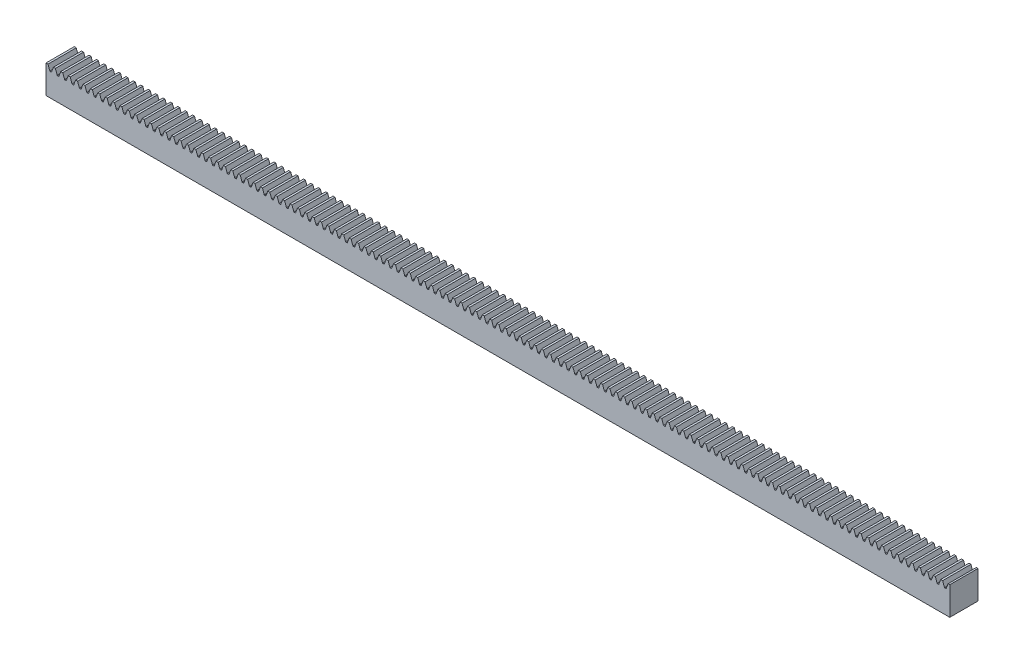
from build123d import *

# Parameters (mm, degrees)
SKETCH1_W           = 609.6
SKETCH1_H           = 19.05
BOSS_EXTRUDE1_DEPTH = 9.525
CUT_EXTRUDE1_DEPTH  = 19.05
FILLET3_R           = 0.320981709
LPATTERN4_START     = -9.525
LPATTERN4_DEPTH     = 19.05


# Read off the part's stored shape, not the designer's step: LPattern4
with BuildPart() as part:
    # Sketch1 → Boss-Extrude1 (new, symmetric)
    with BuildSketch(Plane.XY):
        Rectangle(SKETCH1_W, SKETCH1_H)
    extrude(amount=BOSS_EXTRUDE1_DEPTH, both=True)

    # Sketch2 → Cut-Extrude1 (cut)
    with BuildSketch(Plane.XY.offset(9.525)):
        Polygon((-303.461960494, 9.525), (-302.172304763, 5.9817), (-301.102365731, 5.9817), (-299.81271, 9.525), align=None)
    extrude(amount=-CUT_EXTRUDE1_DEPTH, mode=Mode.SUBTRACT)

    # Fillet3
    fillet3_edges = [part.edges().sort_by_distance(p)[0] for p in [
        (-301.102365731, 5.9817, 0),
        (-302.172304763, 5.9817, 0),
    ]]
    fillet(fillet3_edges, radius=FILLET3_R)

    # LPattern4 outline → LPattern4 (cut)
    with BuildSketch(Plane.XY.offset(LPATTERN4_START)):
        with BuildLine():
            ThreePointArc((-297.261885094, 6.192899499), (-297.144368495, 6.039748886), (-296.96026095, 5.9817))
            Line((-296.96026095, 5.9817), (-296.339829544, 5.9817))
            ThreePointArc((-296.339829544, 5.9817), (-296.155721999, 6.039748886), (-296.0382054, 6.192899499))
            Line((-296.0382054, 6.192899499), (-294.82542, 9.525))
            Line((-294.82542, 9.525), (-298.474670494, 9.525))
            Line((-298.474670494, 9.525), (-297.261885094, 6.192899499))
        make_face()
        with BuildLine():
            Line((303.64938, 9.525), (300.000129506, 9.525))
            Line((300.000129506, 9.525), (301.212914906, 6.192899499))
            ThreePointArc((301.212914906, 6.192899499), (301.330431505, 6.039748886), (301.51453905, 5.9817))
            Line((301.51453905, 5.9817), (302.134970456, 5.9817))
            ThreePointArc((302.134970456, 5.9817), (302.319078001, 6.039748886), (302.4365946, 6.192899499))
            Line((302.4365946, 6.192899499), (303.64938, 9.525))
        make_face()
        with BuildLine():
            Line((298.66209, 9.525), (295.012839506, 9.525))
            Line((295.012839506, 9.525), (296.225624906, 6.192899499))
            ThreePointArc((296.225624906, 6.192899499), (296.343141505, 6.039748886), (296.52724905, 5.9817))
            Line((296.52724905, 5.9817), (297.147680456, 5.9817))
            ThreePointArc((297.147680456, 5.9817), (297.331788001, 6.039748886), (297.4493046, 6.192899499))
            Line((297.4493046, 6.192899499), (298.66209, 9.525))
        make_face()
        with BuildLine():
            Line((293.6748, 9.525), (290.025549506, 9.525))
            Line((290.025549506, 9.525), (291.238334906, 6.192899499))
            ThreePointArc((291.238334906, 6.192899499), (291.355851505, 6.039748886), (291.53995905, 5.9817))
            Line((291.53995905, 5.9817), (292.160390456, 5.9817))
            ThreePointArc((292.160390456, 5.9817), (292.344498001, 6.039748886), (292.4620146, 6.192899499))
            Line((292.4620146, 6.192899499), (293.6748, 9.525))
        make_face()
        with BuildLine():
            Line((288.68751, 9.525), (285.038259506, 9.525))
            Line((285.038259506, 9.525), (286.251044906, 6.192899499))
            ThreePointArc((286.251044906, 6.192899499), (286.368561505, 6.039748886), (286.55266905, 5.9817))
            Line((286.55266905, 5.9817), (287.173100456, 5.9817))
            ThreePointArc((287.173100456, 5.9817), (287.357208001, 6.039748886), (287.4747246, 6.192899499))
            Line((287.4747246, 6.192899499), (288.68751, 9.525))
        make_face()
        with BuildLine():
            Line((283.70022, 9.525), (280.050969506, 9.525))
            Line((280.050969506, 9.525), (281.263754906, 6.192899499))
            ThreePointArc((281.263754906, 6.192899499), (281.381271505, 6.039748886), (281.56537905, 5.9817))
            Line((281.56537905, 5.9817), (282.185810456, 5.9817))
            ThreePointArc((282.185810456, 5.9817), (282.369918001, 6.039748886), (282.4874346, 6.192899499))
            Line((282.4874346, 6.192899499), (283.70022, 9.525))
        make_face()
        with BuildLine():
            Line((278.71293, 9.525), (275.063679506, 9.525))
            Line((275.063679506, 9.525), (276.276464906, 6.192899499))
            ThreePointArc((276.276464906, 6.192899499), (276.393981505, 6.039748886), (276.57808905, 5.9817))
            Line((276.57808905, 5.9817), (277.198520456, 5.9817))
            ThreePointArc((277.198520456, 5.9817), (277.382628001, 6.039748886), (277.5001446, 6.192899499))
            Line((277.5001446, 6.192899499), (278.71293, 9.525))
        make_face()
        with BuildLine():
            Line((273.72564, 9.525), (270.076389506, 9.525))
            Line((270.076389506, 9.525), (271.289174906, 6.192899499))
            ThreePointArc((271.289174906, 6.192899499), (271.406691505, 6.039748886), (271.59079905, 5.9817))
            Line((271.59079905, 5.9817), (272.211230456, 5.9817))
            ThreePointArc((272.211230456, 5.9817), (272.395338001, 6.039748886), (272.5128546, 6.192899499))
            Line((272.5128546, 6.192899499), (273.72564, 9.525))
        make_face()
        with BuildLine():
            Line((268.73835, 9.525), (265.089099506, 9.525))
            Line((265.089099506, 9.525), (266.301884906, 6.192899499))
            ThreePointArc((266.301884906, 6.192899499), (266.419401505, 6.039748886), (266.60350905, 5.9817))
            Line((266.60350905, 5.9817), (267.223940456, 5.9817))
            ThreePointArc((267.223940456, 5.9817), (267.408048001, 6.039748886), (267.5255646, 6.192899499))
            Line((267.5255646, 6.192899499), (268.73835, 9.525))
        make_face()
        with BuildLine():
            Line((263.75106, 9.525), (260.101809506, 9.525))
            Line((260.101809506, 9.525), (261.314594906, 6.192899499))
            ThreePointArc((261.314594906, 6.192899499), (261.432111505, 6.039748886), (261.61621905, 5.9817))
            Line((261.61621905, 5.9817), (262.236650456, 5.9817))
            ThreePointArc((262.236650456, 5.9817), (262.420758001, 6.039748886), (262.5382746, 6.192899499))
            Line((262.5382746, 6.192899499), (263.75106, 9.525))
        make_face()
        with BuildLine():
            Line((258.76377, 9.525), (255.114519506, 9.525))
            Line((255.114519506, 9.525), (256.327304906, 6.192899499))
            ThreePointArc((256.327304906, 6.192899499), (256.444821505, 6.039748886), (256.62892905, 5.9817))
            Line((256.62892905, 5.9817), (257.249360456, 5.9817))
            ThreePointArc((257.249360456, 5.9817), (257.433468001, 6.039748886), (257.5509846, 6.192899499))
            Line((257.5509846, 6.192899499), (258.76377, 9.525))
        make_face()
        with BuildLine():
            Line((253.77648, 9.525), (250.127229506, 9.525))
            Line((250.127229506, 9.525), (251.340014906, 6.192899499))
            ThreePointArc((251.340014906, 6.192899499), (251.457531505, 6.039748886), (251.64163905, 5.9817))
            Line((251.64163905, 5.9817), (252.262070456, 5.9817))
            ThreePointArc((252.262070456, 5.9817), (252.446178001, 6.039748886), (252.5636946, 6.192899499))
            Line((252.5636946, 6.192899499), (253.77648, 9.525))
        make_face()
        with BuildLine():
            Line((248.78919, 9.525), (245.139939506, 9.525))
            Line((245.139939506, 9.525), (246.352724906, 6.192899499))
            ThreePointArc((246.352724906, 6.192899499), (246.470241505, 6.039748886), (246.65434905, 5.9817))
            Line((246.65434905, 5.9817), (247.274780456, 5.9817))
            ThreePointArc((247.274780456, 5.9817), (247.458888001, 6.039748886), (247.5764046, 6.192899499))
            Line((247.5764046, 6.192899499), (248.78919, 9.525))
        make_face()
        with BuildLine():
            Line((243.8019, 9.525), (240.152649506, 9.525))
            Line((240.152649506, 9.525), (241.365434906, 6.192899499))
            ThreePointArc((241.365434906, 6.192899499), (241.482951505, 6.039748886), (241.66705905, 5.9817))
            Line((241.66705905, 5.9817), (242.287490456, 5.9817))
            ThreePointArc((242.287490456, 5.9817), (242.471598001, 6.039748886), (242.5891146, 6.192899499))
            Line((242.5891146, 6.192899499), (243.8019, 9.525))
        make_face()
        with BuildLine():
            Line((238.81461, 9.525), (235.165359506, 9.525))
            Line((235.165359506, 9.525), (236.378144906, 6.192899499))
            ThreePointArc((236.378144906, 6.192899499), (236.495661505, 6.039748886), (236.67976905, 5.9817))
            Line((236.67976905, 5.9817), (237.300200456, 5.9817))
            ThreePointArc((237.300200456, 5.9817), (237.484308001, 6.039748886), (237.6018246, 6.192899499))
            Line((237.6018246, 6.192899499), (238.81461, 9.525))
        make_face()
        with BuildLine():
            Line((233.82732, 9.525), (230.178069506, 9.525))
            Line((230.178069506, 9.525), (231.390854906, 6.192899499))
            ThreePointArc((231.390854906, 6.192899499), (231.508371505, 6.039748886), (231.69247905, 5.9817))
            Line((231.69247905, 5.9817), (232.312910456, 5.9817))
            ThreePointArc((232.312910456, 5.9817), (232.497018001, 6.039748886), (232.6145346, 6.192899499))
            Line((232.6145346, 6.192899499), (233.82732, 9.525))
        make_face()
        with BuildLine():
            Line((228.84003, 9.525), (225.190779506, 9.525))
            Line((225.190779506, 9.525), (226.403564906, 6.192899499))
            ThreePointArc((226.403564906, 6.192899499), (226.521081505, 6.039748886), (226.70518905, 5.9817))
            Line((226.70518905, 5.9817), (227.325620456, 5.9817))
            ThreePointArc((227.325620456, 5.9817), (227.509728001, 6.039748886), (227.6272446, 6.192899499))
            Line((227.6272446, 6.192899499), (228.84003, 9.525))
        make_face()
        with BuildLine():
            Line((223.85274, 9.525), (220.203489506, 9.525))
            Line((220.203489506, 9.525), (221.416274906, 6.192899499))
            ThreePointArc((221.416274906, 6.192899499), (221.533791505, 6.039748886), (221.71789905, 5.9817))
            Line((221.71789905, 5.9817), (222.338330456, 5.9817))
            ThreePointArc((222.338330456, 5.9817), (222.522438001, 6.039748886), (222.6399546, 6.192899499))
            Line((222.6399546, 6.192899499), (223.85274, 9.525))
        make_face()
        with BuildLine():
            Line((218.86545, 9.525), (215.216199506, 9.525))
            Line((215.216199506, 9.525), (216.428984906, 6.192899499))
            ThreePointArc((216.428984906, 6.192899499), (216.546501505, 6.039748886), (216.73060905, 5.9817))
            Line((216.73060905, 5.9817), (217.351040456, 5.9817))
            ThreePointArc((217.351040456, 5.9817), (217.535148001, 6.039748886), (217.6526646, 6.192899499))
            Line((217.6526646, 6.192899499), (218.86545, 9.525))
        make_face()
        with BuildLine():
            Line((213.87816, 9.525), (210.228909506, 9.525))
            Line((210.228909506, 9.525), (211.441694906, 6.192899499))
            ThreePointArc((211.441694906, 6.192899499), (211.559211505, 6.039748886), (211.74331905, 5.9817))
            Line((211.74331905, 5.9817), (212.363750456, 5.9817))
            ThreePointArc((212.363750456, 5.9817), (212.547858001, 6.039748886), (212.6653746, 6.192899499))
            Line((212.6653746, 6.192899499), (213.87816, 9.525))
        make_face()
        with BuildLine():
            Line((208.89087, 9.525), (205.241619506, 9.525))
            Line((205.241619506, 9.525), (206.454404906, 6.192899499))
            ThreePointArc((206.454404906, 6.192899499), (206.571921505, 6.039748886), (206.75602905, 5.9817))
            Line((206.75602905, 5.9817), (207.376460456, 5.9817))
            ThreePointArc((207.376460456, 5.9817), (207.560568001, 6.039748886), (207.6780846, 6.192899499))
            Line((207.6780846, 6.192899499), (208.89087, 9.525))
        make_face()
        with BuildLine():
            Line((203.90358, 9.525), (200.254329506, 9.525))
            Line((200.254329506, 9.525), (201.467114906, 6.192899499))
            ThreePointArc((201.467114906, 6.192899499), (201.584631505, 6.039748886), (201.76873905, 5.9817))
            Line((201.76873905, 5.9817), (202.389170456, 5.9817))
            ThreePointArc((202.389170456, 5.9817), (202.573278001, 6.039748886), (202.6907946, 6.192899499))
            Line((202.6907946, 6.192899499), (203.90358, 9.525))
        make_face()
        with BuildLine():
            Line((198.91629, 9.525), (195.267039506, 9.525))
            Line((195.267039506, 9.525), (196.479824906, 6.192899499))
            ThreePointArc((196.479824906, 6.192899499), (196.597341505, 6.039748886), (196.78144905, 5.9817))
            Line((196.78144905, 5.9817), (197.401880456, 5.9817))
            ThreePointArc((197.401880456, 5.9817), (197.585988001, 6.039748886), (197.7035046, 6.192899499))
            Line((197.7035046, 6.192899499), (198.91629, 9.525))
        make_face()
        with BuildLine():
            Line((193.929, 9.525), (190.279749506, 9.525))
            Line((190.279749506, 9.525), (191.492534906, 6.192899499))
            ThreePointArc((191.492534906, 6.192899499), (191.610051505, 6.039748886), (191.79415905, 5.9817))
            Line((191.79415905, 5.9817), (192.414590456, 5.9817))
            ThreePointArc((192.414590456, 5.9817), (192.598698001, 6.039748886), (192.7162146, 6.192899499))
            Line((192.7162146, 6.192899499), (193.929, 9.525))
        make_face()
        with BuildLine():
            Line((188.94171, 9.525), (185.292459506, 9.525))
            Line((185.292459506, 9.525), (186.505244906, 6.192899499))
            ThreePointArc((186.505244906, 6.192899499), (186.622761505, 6.039748886), (186.80686905, 5.9817))
            Line((186.80686905, 5.9817), (187.427300456, 5.9817))
            ThreePointArc((187.427300456, 5.9817), (187.611408001, 6.039748886), (187.7289246, 6.192899499))
            Line((187.7289246, 6.192899499), (188.94171, 9.525))
        make_face()
        with BuildLine():
            Line((183.95442, 9.525), (180.305169506, 9.525))
            Line((180.305169506, 9.525), (181.517954906, 6.192899499))
            ThreePointArc((181.517954906, 6.192899499), (181.635471505, 6.039748886), (181.81957905, 5.9817))
            Line((181.81957905, 5.9817), (182.440010456, 5.9817))
            ThreePointArc((182.440010456, 5.9817), (182.624118001, 6.039748886), (182.7416346, 6.192899499))
            Line((182.7416346, 6.192899499), (183.95442, 9.525))
        make_face()
        with BuildLine():
            Line((178.96713, 9.525), (175.317879506, 9.525))
            Line((175.317879506, 9.525), (176.530664906, 6.192899499))
            ThreePointArc((176.530664906, 6.192899499), (176.648181505, 6.039748886), (176.83228905, 5.9817))
            Line((176.83228905, 5.9817), (177.452720456, 5.9817))
            ThreePointArc((177.452720456, 5.9817), (177.636828001, 6.039748886), (177.7543446, 6.192899499))
            Line((177.7543446, 6.192899499), (178.96713, 9.525))
        make_face()
        with BuildLine():
            Line((173.97984, 9.525), (170.330589506, 9.525))
            Line((170.330589506, 9.525), (171.543374906, 6.192899499))
            ThreePointArc((171.543374906, 6.192899499), (171.660891505, 6.039748886), (171.84499905, 5.9817))
            Line((171.84499905, 5.9817), (172.465430456, 5.9817))
            ThreePointArc((172.465430456, 5.9817), (172.649538001, 6.039748886), (172.7670546, 6.192899499))
            Line((172.7670546, 6.192899499), (173.97984, 9.525))
        make_face()
        with BuildLine():
            Line((168.99255, 9.525), (165.343299506, 9.525))
            Line((165.343299506, 9.525), (166.556084906, 6.192899499))
            ThreePointArc((166.556084906, 6.192899499), (166.673601505, 6.039748886), (166.85770905, 5.9817))
            Line((166.85770905, 5.9817), (167.478140456, 5.9817))
            ThreePointArc((167.478140456, 5.9817), (167.662248001, 6.039748886), (167.7797646, 6.192899499))
            Line((167.7797646, 6.192899499), (168.99255, 9.525))
        make_face()
        with BuildLine():
            Line((164.00526, 9.525), (160.356009506, 9.525))
            Line((160.356009506, 9.525), (161.568794906, 6.192899499))
            ThreePointArc((161.568794906, 6.192899499), (161.686311505, 6.039748886), (161.87041905, 5.9817))
            Line((161.87041905, 5.9817), (162.490850456, 5.9817))
            ThreePointArc((162.490850456, 5.9817), (162.674958001, 6.039748886), (162.7924746, 6.192899499))
            Line((162.7924746, 6.192899499), (164.00526, 9.525))
        make_face()
        with BuildLine():
            Line((159.01797, 9.525), (155.368719506, 9.525))
            Line((155.368719506, 9.525), (156.581504906, 6.192899499))
            ThreePointArc((156.581504906, 6.192899499), (156.699021505, 6.039748886), (156.88312905, 5.9817))
            Line((156.88312905, 5.9817), (157.503560456, 5.9817))
            ThreePointArc((157.503560456, 5.9817), (157.687668001, 6.039748886), (157.8051846, 6.192899499))
            Line((157.8051846, 6.192899499), (159.01797, 9.525))
        make_face()
        with BuildLine():
            Line((154.03068, 9.525), (150.381429506, 9.525))
            Line((150.381429506, 9.525), (151.594214906, 6.192899499))
            ThreePointArc((151.594214906, 6.192899499), (151.711731505, 6.039748886), (151.89583905, 5.9817))
            Line((151.89583905, 5.9817), (152.516270456, 5.9817))
            ThreePointArc((152.516270456, 5.9817), (152.700378001, 6.039748886), (152.8178946, 6.192899499))
            Line((152.8178946, 6.192899499), (154.03068, 9.525))
        make_face()
        with BuildLine():
            Line((149.04339, 9.525), (145.394139506, 9.525))
            Line((145.394139506, 9.525), (146.606924906, 6.192899499))
            ThreePointArc((146.606924906, 6.192899499), (146.724441505, 6.039748886), (146.90854905, 5.9817))
            Line((146.90854905, 5.9817), (147.528980456, 5.9817))
            ThreePointArc((147.528980456, 5.9817), (147.713088001, 6.039748886), (147.8306046, 6.192899499))
            Line((147.8306046, 6.192899499), (149.04339, 9.525))
        make_face()
        with BuildLine():
            Line((144.0561, 9.525), (140.406849506, 9.525))
            Line((140.406849506, 9.525), (141.619634906, 6.192899499))
            ThreePointArc((141.619634906, 6.192899499), (141.737151505, 6.039748886), (141.92125905, 5.9817))
            Line((141.92125905, 5.9817), (142.541690456, 5.9817))
            ThreePointArc((142.541690456, 5.9817), (142.725798001, 6.039748886), (142.8433146, 6.192899499))
            Line((142.8433146, 6.192899499), (144.0561, 9.525))
        make_face()
        with BuildLine():
            Line((139.06881, 9.525), (135.419559506, 9.525))
            Line((135.419559506, 9.525), (136.632344906, 6.192899499))
            ThreePointArc((136.632344906, 6.192899499), (136.749861505, 6.039748886), (136.93396905, 5.9817))
            Line((136.93396905, 5.9817), (137.554400456, 5.9817))
            ThreePointArc((137.554400456, 5.9817), (137.738508001, 6.039748886), (137.8560246, 6.192899499))
            Line((137.8560246, 6.192899499), (139.06881, 9.525))
        make_face()
        with BuildLine():
            Line((134.08152, 9.525), (130.432269506, 9.525))
            Line((130.432269506, 9.525), (131.645054906, 6.192899499))
            ThreePointArc((131.645054906, 6.192899499), (131.762571505, 6.039748886), (131.94667905, 5.9817))
            Line((131.94667905, 5.9817), (132.567110456, 5.9817))
            ThreePointArc((132.567110456, 5.9817), (132.751218001, 6.039748886), (132.8687346, 6.192899499))
            Line((132.8687346, 6.192899499), (134.08152, 9.525))
        make_face()
        with BuildLine():
            Line((129.09423, 9.525), (125.444979506, 9.525))
            Line((125.444979506, 9.525), (126.657764906, 6.192899499))
            ThreePointArc((126.657764906, 6.192899499), (126.775281505, 6.039748886), (126.95938905, 5.9817))
            Line((126.95938905, 5.9817), (127.579820456, 5.9817))
            ThreePointArc((127.579820456, 5.9817), (127.763928001, 6.039748886), (127.8814446, 6.192899499))
            Line((127.8814446, 6.192899499), (129.09423, 9.525))
        make_face()
        with BuildLine():
            Line((124.10694, 9.525), (120.457689506, 9.525))
            Line((120.457689506, 9.525), (121.670474906, 6.192899499))
            ThreePointArc((121.670474906, 6.192899499), (121.787991505, 6.039748886), (121.97209905, 5.9817))
            Line((121.97209905, 5.9817), (122.592530456, 5.9817))
            ThreePointArc((122.592530456, 5.9817), (122.776638001, 6.039748886), (122.8941546, 6.192899499))
            Line((122.8941546, 6.192899499), (124.10694, 9.525))
        make_face()
        with BuildLine():
            Line((119.11965, 9.525), (115.470399506, 9.525))
            Line((115.470399506, 9.525), (116.683184906, 6.192899499))
            ThreePointArc((116.683184906, 6.192899499), (116.800701505, 6.039748886), (116.98480905, 5.9817))
            Line((116.98480905, 5.9817), (117.605240456, 5.9817))
            ThreePointArc((117.605240456, 5.9817), (117.789348001, 6.039748886), (117.9068646, 6.192899499))
            Line((117.9068646, 6.192899499), (119.11965, 9.525))
        make_face()
        with BuildLine():
            Line((114.13236, 9.525), (110.483109506, 9.525))
            Line((110.483109506, 9.525), (111.695894906, 6.192899499))
            ThreePointArc((111.695894906, 6.192899499), (111.813411505, 6.039748886), (111.99751905, 5.9817))
            Line((111.99751905, 5.9817), (112.617950456, 5.9817))
            ThreePointArc((112.617950456, 5.9817), (112.802058001, 6.039748886), (112.9195746, 6.192899499))
            Line((112.9195746, 6.192899499), (114.13236, 9.525))
        make_face()
        with BuildLine():
            Line((109.14507, 9.525), (105.495819506, 9.525))
            Line((105.495819506, 9.525), (106.708604906, 6.192899499))
            ThreePointArc((106.708604906, 6.192899499), (106.826121505, 6.039748886), (107.01022905, 5.9817))
            Line((107.01022905, 5.9817), (107.630660456, 5.9817))
            ThreePointArc((107.630660456, 5.9817), (107.814768001, 6.039748886), (107.9322846, 6.192899499))
            Line((107.9322846, 6.192899499), (109.14507, 9.525))
        make_face()
        with BuildLine():
            Line((104.15778, 9.525), (100.508529506, 9.525))
            Line((100.508529506, 9.525), (101.721314906, 6.192899499))
            ThreePointArc((101.721314906, 6.192899499), (101.838831505, 6.039748886), (102.02293905, 5.9817))
            Line((102.02293905, 5.9817), (102.643370456, 5.9817))
            ThreePointArc((102.643370456, 5.9817), (102.827478001, 6.039748886), (102.9449946, 6.192899499))
            Line((102.9449946, 6.192899499), (104.15778, 9.525))
        make_face()
        with BuildLine():
            Line((99.17049, 9.525), (95.521239506, 9.525))
            Line((95.521239506, 9.525), (96.734024906, 6.192899499))
            ThreePointArc((96.734024906, 6.192899499), (96.851541505, 6.039748886), (97.03564905, 5.9817))
            Line((97.03564905, 5.9817), (97.656080456, 5.9817))
            ThreePointArc((97.656080456, 5.9817), (97.840188001, 6.039748886), (97.9577046, 6.192899499))
            Line((97.9577046, 6.192899499), (99.17049, 9.525))
        make_face()
        with BuildLine():
            Line((94.1832, 9.525), (90.533949506, 9.525))
            Line((90.533949506, 9.525), (91.746734906, 6.192899499))
            ThreePointArc((91.746734906, 6.192899499), (91.864251505, 6.039748886), (92.04835905, 5.9817))
            Line((92.04835905, 5.9817), (92.668790456, 5.9817))
            ThreePointArc((92.668790456, 5.9817), (92.852898001, 6.039748886), (92.9704146, 6.192899499))
            Line((92.9704146, 6.192899499), (94.1832, 9.525))
        make_face()
        with BuildLine():
            Line((89.19591, 9.525), (85.546659506, 9.525))
            Line((85.546659506, 9.525), (86.759444906, 6.192899499))
            ThreePointArc((86.759444906, 6.192899499), (86.876961505, 6.039748886), (87.06106905, 5.9817))
            Line((87.06106905, 5.9817), (87.681500456, 5.9817))
            ThreePointArc((87.681500456, 5.9817), (87.865608001, 6.039748886), (87.9831246, 6.192899499))
            Line((87.9831246, 6.192899499), (89.19591, 9.525))
        make_face()
        with BuildLine():
            Line((84.20862, 9.525), (80.559369506, 9.525))
            Line((80.559369506, 9.525), (81.772154906, 6.192899499))
            ThreePointArc((81.772154906, 6.192899499), (81.889671505, 6.039748886), (82.07377905, 5.9817))
            Line((82.07377905, 5.9817), (82.694210456, 5.9817))
            ThreePointArc((82.694210456, 5.9817), (82.878318001, 6.039748886), (82.9958346, 6.192899499))
            Line((82.9958346, 6.192899499), (84.20862, 9.525))
        make_face()
        with BuildLine():
            Line((79.22133, 9.525), (75.572079506, 9.525))
            Line((75.572079506, 9.525), (76.784864906, 6.192899499))
            ThreePointArc((76.784864906, 6.192899499), (76.902381505, 6.039748886), (77.08648905, 5.9817))
            Line((77.08648905, 5.9817), (77.706920456, 5.9817))
            ThreePointArc((77.706920456, 5.9817), (77.891028001, 6.039748886), (78.0085446, 6.192899499))
            Line((78.0085446, 6.192899499), (79.22133, 9.525))
        make_face()
        with BuildLine():
            Line((74.23404, 9.525), (70.584789506, 9.525))
            Line((70.584789506, 9.525), (71.797574906, 6.192899499))
            ThreePointArc((71.797574906, 6.192899499), (71.915091505, 6.039748886), (72.09919905, 5.9817))
            Line((72.09919905, 5.9817), (72.719630456, 5.9817))
            ThreePointArc((72.719630456, 5.9817), (72.903738001, 6.039748886), (73.0212546, 6.192899499))
            Line((73.0212546, 6.192899499), (74.23404, 9.525))
        make_face()
        with BuildLine():
            Line((69.24675, 9.525), (65.597499506, 9.525))
            Line((65.597499506, 9.525), (66.810284906, 6.192899499))
            ThreePointArc((66.810284906, 6.192899499), (66.927801505, 6.039748886), (67.11190905, 5.9817))
            Line((67.11190905, 5.9817), (67.732340456, 5.9817))
            ThreePointArc((67.732340456, 5.9817), (67.916448001, 6.039748886), (68.0339646, 6.192899499))
            Line((68.0339646, 6.192899499), (69.24675, 9.525))
        make_face()
        with BuildLine():
            Line((64.25946, 9.525), (60.610209506, 9.525))
            Line((60.610209506, 9.525), (61.822994906, 6.192899499))
            ThreePointArc((61.822994906, 6.192899499), (61.940511505, 6.039748886), (62.12461905, 5.9817))
            Line((62.12461905, 5.9817), (62.745050456, 5.9817))
            ThreePointArc((62.745050456, 5.9817), (62.929158001, 6.039748886), (63.0466746, 6.192899499))
            Line((63.0466746, 6.192899499), (64.25946, 9.525))
        make_face()
        with BuildLine():
            Line((59.27217, 9.525), (55.622919506, 9.525))
            Line((55.622919506, 9.525), (56.835704906, 6.192899499))
            ThreePointArc((56.835704906, 6.192899499), (56.953221505, 6.039748886), (57.13732905, 5.9817))
            Line((57.13732905, 5.9817), (57.757760456, 5.9817))
            ThreePointArc((57.757760456, 5.9817), (57.941868001, 6.039748886), (58.0593846, 6.192899499))
            Line((58.0593846, 6.192899499), (59.27217, 9.525))
        make_face()
        with BuildLine():
            Line((54.28488, 9.525), (50.635629506, 9.525))
            Line((50.635629506, 9.525), (51.848414906, 6.192899499))
            ThreePointArc((51.848414906, 6.192899499), (51.965931505, 6.039748886), (52.15003905, 5.9817))
            Line((52.15003905, 5.9817), (52.770470456, 5.9817))
            ThreePointArc((52.770470456, 5.9817), (52.954578001, 6.039748886), (53.0720946, 6.192899499))
            Line((53.0720946, 6.192899499), (54.28488, 9.525))
        make_face()
        with BuildLine():
            Line((49.29759, 9.525), (45.648339506, 9.525))
            Line((45.648339506, 9.525), (46.861124906, 6.192899499))
            ThreePointArc((46.861124906, 6.192899499), (46.978641505, 6.039748886), (47.16274905, 5.9817))
            Line((47.16274905, 5.9817), (47.783180456, 5.9817))
            ThreePointArc((47.783180456, 5.9817), (47.967288001, 6.039748886), (48.0848046, 6.192899499))
            Line((48.0848046, 6.192899499), (49.29759, 9.525))
        make_face()
        with BuildLine():
            Line((44.3103, 9.525), (40.661049506, 9.525))
            Line((40.661049506, 9.525), (41.873834906, 6.192899499))
            ThreePointArc((41.873834906, 6.192899499), (41.991351505, 6.039748886), (42.17545905, 5.9817))
            Line((42.17545905, 5.9817), (42.795890456, 5.9817))
            ThreePointArc((42.795890456, 5.9817), (42.979998001, 6.039748886), (43.0975146, 6.192899499))
            Line((43.0975146, 6.192899499), (44.3103, 9.525))
        make_face()
        with BuildLine():
            Line((39.32301, 9.525), (35.673759506, 9.525))
            Line((35.673759506, 9.525), (36.886544906, 6.192899499))
            ThreePointArc((36.886544906, 6.192899499), (37.004061505, 6.039748886), (37.18816905, 5.9817))
            Line((37.18816905, 5.9817), (37.808600456, 5.9817))
            ThreePointArc((37.808600456, 5.9817), (37.992708001, 6.039748886), (38.1102246, 6.192899499))
            Line((38.1102246, 6.192899499), (39.32301, 9.525))
        make_face()
        with BuildLine():
            Line((34.33572, 9.525), (30.686469506, 9.525))
            Line((30.686469506, 9.525), (31.899254906, 6.192899499))
            ThreePointArc((31.899254906, 6.192899499), (32.016771505, 6.039748886), (32.20087905, 5.9817))
            Line((32.20087905, 5.9817), (32.821310456, 5.9817))
            ThreePointArc((32.821310456, 5.9817), (33.005418001, 6.039748886), (33.1229346, 6.192899499))
            Line((33.1229346, 6.192899499), (34.33572, 9.525))
        make_face()
        with BuildLine():
            Line((29.34843, 9.525), (25.699179506, 9.525))
            Line((25.699179506, 9.525), (26.911964906, 6.192899499))
            ThreePointArc((26.911964906, 6.192899499), (27.029481505, 6.039748886), (27.21358905, 5.9817))
            Line((27.21358905, 5.9817), (27.834020456, 5.9817))
            ThreePointArc((27.834020456, 5.9817), (28.018128001, 6.039748886), (28.1356446, 6.192899499))
            Line((28.1356446, 6.192899499), (29.34843, 9.525))
        make_face()
        with BuildLine():
            Line((24.36114, 9.525), (20.711889506, 9.525))
            Line((20.711889506, 9.525), (21.924674906, 6.192899499))
            ThreePointArc((21.924674906, 6.192899499), (22.042191505, 6.039748886), (22.22629905, 5.9817))
            Line((22.22629905, 5.9817), (22.846730456, 5.9817))
            ThreePointArc((22.846730456, 5.9817), (23.030838001, 6.039748886), (23.1483546, 6.192899499))
            Line((23.1483546, 6.192899499), (24.36114, 9.525))
        make_face()
        with BuildLine():
            Line((19.37385, 9.525), (15.724599506, 9.525))
            Line((15.724599506, 9.525), (16.937384906, 6.192899499))
            ThreePointArc((16.937384906, 6.192899499), (17.054901505, 6.039748886), (17.23900905, 5.9817))
            Line((17.23900905, 5.9817), (17.859440456, 5.9817))
            ThreePointArc((17.859440456, 5.9817), (18.043548001, 6.039748886), (18.1610646, 6.192899499))
            Line((18.1610646, 6.192899499), (19.37385, 9.525))
        make_face()
        with BuildLine():
            Line((14.38656, 9.525), (10.737309506, 9.525))
            Line((10.737309506, 9.525), (11.950094906, 6.192899499))
            ThreePointArc((11.950094906, 6.192899499), (12.067611505, 6.039748886), (12.25171905, 5.9817))
            Line((12.25171905, 5.9817), (12.872150456, 5.9817))
            ThreePointArc((12.872150456, 5.9817), (13.056258001, 6.039748886), (13.1737746, 6.192899499))
            Line((13.1737746, 6.192899499), (14.38656, 9.525))
        make_face()
        with BuildLine():
            Line((9.39927, 9.525), (5.750019506, 9.525))
            Line((5.750019506, 9.525), (6.962804906, 6.192899499))
            ThreePointArc((6.962804906, 6.192899499), (7.080321505, 6.039748886), (7.26442905, 5.9817))
            Line((7.26442905, 5.9817), (7.884860456, 5.9817))
            ThreePointArc((7.884860456, 5.9817), (8.068968001, 6.039748886), (8.1864846, 6.192899499))
            Line((8.1864846, 6.192899499), (9.39927, 9.525))
        make_face()
        with BuildLine():
            Line((4.41198, 9.525), (0.762729506, 9.525))
            Line((0.762729506, 9.525), (1.975514906, 6.192899499))
            ThreePointArc((1.975514906, 6.192899499), (2.093031505, 6.039748886), (2.27713905, 5.9817))
            Line((2.27713905, 5.9817), (2.897570456, 5.9817))
            ThreePointArc((2.897570456, 5.9817), (3.081678001, 6.039748886), (3.1991946, 6.192899499))
            Line((3.1991946, 6.192899499), (4.41198, 9.525))
        make_face()
        with BuildLine():
            Line((-0.57531, 9.525), (-4.224560494, 9.525))
            Line((-4.224560494, 9.525), (-3.011775094, 6.192899499))
            ThreePointArc((-3.011775094, 6.192899499), (-2.894258495, 6.039748886), (-2.71015095, 5.9817))
            Line((-2.71015095, 5.9817), (-2.089719544, 5.9817))
            ThreePointArc((-2.089719544, 5.9817), (-1.905611999, 6.039748886), (-1.7880954, 6.192899499))
            Line((-1.7880954, 6.192899499), (-0.57531, 9.525))
        make_face()
        with BuildLine():
            Line((-5.5626, 9.525), (-9.211850494, 9.525))
            Line((-9.211850494, 9.525), (-7.999065094, 6.192899499))
            ThreePointArc((-7.999065094, 6.192899499), (-7.881548495, 6.039748886), (-7.69744095, 5.9817))
            Line((-7.69744095, 5.9817), (-7.077009544, 5.9817))
            ThreePointArc((-7.077009544, 5.9817), (-6.892901999, 6.039748886), (-6.7753854, 6.192899499))
            Line((-6.7753854, 6.192899499), (-5.5626, 9.525))
        make_face()
        with BuildLine():
            Line((-10.54989, 9.525), (-14.199140494, 9.525))
            Line((-14.199140494, 9.525), (-12.986355094, 6.192899499))
            ThreePointArc((-12.986355094, 6.192899499), (-12.868838495, 6.039748886), (-12.68473095, 5.9817))
            Line((-12.68473095, 5.9817), (-12.064299544, 5.9817))
            ThreePointArc((-12.064299544, 5.9817), (-11.880191999, 6.039748886), (-11.7626754, 6.192899499))
            Line((-11.7626754, 6.192899499), (-10.54989, 9.525))
        make_face()
        with BuildLine():
            Line((-15.53718, 9.525), (-19.186430494, 9.525))
            Line((-19.186430494, 9.525), (-17.973645094, 6.192899499))
            ThreePointArc((-17.973645094, 6.192899499), (-17.856128495, 6.039748886), (-17.67202095, 5.9817))
            Line((-17.67202095, 5.9817), (-17.051589544, 5.9817))
            ThreePointArc((-17.051589544, 5.9817), (-16.867481999, 6.039748886), (-16.7499654, 6.192899499))
            Line((-16.7499654, 6.192899499), (-15.53718, 9.525))
        make_face()
        with BuildLine():
            Line((-20.52447, 9.525), (-24.173720494, 9.525))
            Line((-24.173720494, 9.525), (-22.960935094, 6.192899499))
            ThreePointArc((-22.960935094, 6.192899499), (-22.843418495, 6.039748886), (-22.65931095, 5.9817))
            Line((-22.65931095, 5.9817), (-22.038879544, 5.9817))
            ThreePointArc((-22.038879544, 5.9817), (-21.854771999, 6.039748886), (-21.7372554, 6.192899499))
            Line((-21.7372554, 6.192899499), (-20.52447, 9.525))
        make_face()
        with BuildLine():
            Line((-25.51176, 9.525), (-29.161010494, 9.525))
            Line((-29.161010494, 9.525), (-27.948225094, 6.192899499))
            ThreePointArc((-27.948225094, 6.192899499), (-27.830708495, 6.039748886), (-27.64660095, 5.9817))
            Line((-27.64660095, 5.9817), (-27.026169544, 5.9817))
            ThreePointArc((-27.026169544, 5.9817), (-26.842061999, 6.039748886), (-26.7245454, 6.192899499))
            Line((-26.7245454, 6.192899499), (-25.51176, 9.525))
        make_face()
        with BuildLine():
            Line((-30.49905, 9.525), (-34.148300494, 9.525))
            Line((-34.148300494, 9.525), (-32.935515094, 6.192899499))
            ThreePointArc((-32.935515094, 6.192899499), (-32.817998495, 6.039748886), (-32.63389095, 5.9817))
            Line((-32.63389095, 5.9817), (-32.013459544, 5.9817))
            ThreePointArc((-32.013459544, 5.9817), (-31.829351999, 6.039748886), (-31.7118354, 6.192899499))
            Line((-31.7118354, 6.192899499), (-30.49905, 9.525))
        make_face()
        with BuildLine():
            Line((-35.48634, 9.525), (-39.135590494, 9.525))
            Line((-39.135590494, 9.525), (-37.922805094, 6.192899499))
            ThreePointArc((-37.922805094, 6.192899499), (-37.805288495, 6.039748886), (-37.62118095, 5.9817))
            Line((-37.62118095, 5.9817), (-37.000749544, 5.9817))
            ThreePointArc((-37.000749544, 5.9817), (-36.816641999, 6.039748886), (-36.6991254, 6.192899499))
            Line((-36.6991254, 6.192899499), (-35.48634, 9.525))
        make_face()
        with BuildLine():
            Line((-40.47363, 9.525), (-44.122880494, 9.525))
            Line((-44.122880494, 9.525), (-42.910095094, 6.192899499))
            ThreePointArc((-42.910095094, 6.192899499), (-42.792578495, 6.039748886), (-42.60847095, 5.9817))
            Line((-42.60847095, 5.9817), (-41.988039544, 5.9817))
            ThreePointArc((-41.988039544, 5.9817), (-41.803931999, 6.039748886), (-41.6864154, 6.192899499))
            Line((-41.6864154, 6.192899499), (-40.47363, 9.525))
        make_face()
        with BuildLine():
            Line((-45.46092, 9.525), (-49.110170494, 9.525))
            Line((-49.110170494, 9.525), (-47.897385094, 6.192899499))
            ThreePointArc((-47.897385094, 6.192899499), (-47.779868495, 6.039748886), (-47.59576095, 5.9817))
            Line((-47.59576095, 5.9817), (-46.975329544, 5.9817))
            ThreePointArc((-46.975329544, 5.9817), (-46.791221999, 6.039748886), (-46.6737054, 6.192899499))
            Line((-46.6737054, 6.192899499), (-45.46092, 9.525))
        make_face()
        with BuildLine():
            Line((-50.44821, 9.525), (-54.097460494, 9.525))
            Line((-54.097460494, 9.525), (-52.884675094, 6.192899499))
            ThreePointArc((-52.884675094, 6.192899499), (-52.767158495, 6.039748886), (-52.58305095, 5.9817))
            Line((-52.58305095, 5.9817), (-51.962619544, 5.9817))
            ThreePointArc((-51.962619544, 5.9817), (-51.778511999, 6.039748886), (-51.6609954, 6.192899499))
            Line((-51.6609954, 6.192899499), (-50.44821, 9.525))
        make_face()
        with BuildLine():
            Line((-55.4355, 9.525), (-59.084750494, 9.525))
            Line((-59.084750494, 9.525), (-57.871965094, 6.192899499))
            ThreePointArc((-57.871965094, 6.192899499), (-57.754448495, 6.039748886), (-57.57034095, 5.9817))
            Line((-57.57034095, 5.9817), (-56.949909544, 5.9817))
            ThreePointArc((-56.949909544, 5.9817), (-56.765801999, 6.039748886), (-56.6482854, 6.192899499))
            Line((-56.6482854, 6.192899499), (-55.4355, 9.525))
        make_face()
        with BuildLine():
            Line((-60.42279, 9.525), (-64.072040494, 9.525))
            Line((-64.072040494, 9.525), (-62.859255094, 6.192899499))
            ThreePointArc((-62.859255094, 6.192899499), (-62.741738495, 6.039748886), (-62.55763095, 5.9817))
            Line((-62.55763095, 5.9817), (-61.937199544, 5.9817))
            ThreePointArc((-61.937199544, 5.9817), (-61.753091999, 6.039748886), (-61.6355754, 6.192899499))
            Line((-61.6355754, 6.192899499), (-60.42279, 9.525))
        make_face()
        with BuildLine():
            Line((-65.41008, 9.525), (-69.059330494, 9.525))
            Line((-69.059330494, 9.525), (-67.846545094, 6.192899499))
            ThreePointArc((-67.846545094, 6.192899499), (-67.729028495, 6.039748886), (-67.54492095, 5.9817))
            Line((-67.54492095, 5.9817), (-66.924489544, 5.9817))
            ThreePointArc((-66.924489544, 5.9817), (-66.740381999, 6.039748886), (-66.6228654, 6.192899499))
            Line((-66.6228654, 6.192899499), (-65.41008, 9.525))
        make_face()
        with BuildLine():
            Line((-70.39737, 9.525), (-74.046620494, 9.525))
            Line((-74.046620494, 9.525), (-72.833835094, 6.192899499))
            ThreePointArc((-72.833835094, 6.192899499), (-72.716318495, 6.039748886), (-72.53221095, 5.9817))
            Line((-72.53221095, 5.9817), (-71.911779544, 5.9817))
            ThreePointArc((-71.911779544, 5.9817), (-71.727671999, 6.039748886), (-71.6101554, 6.192899499))
            Line((-71.6101554, 6.192899499), (-70.39737, 9.525))
        make_face()
        with BuildLine():
            Line((-75.38466, 9.525), (-79.033910494, 9.525))
            Line((-79.033910494, 9.525), (-77.821125094, 6.192899499))
            ThreePointArc((-77.821125094, 6.192899499), (-77.703608495, 6.039748886), (-77.51950095, 5.9817))
            Line((-77.51950095, 5.9817), (-76.899069544, 5.9817))
            ThreePointArc((-76.899069544, 5.9817), (-76.714961999, 6.039748886), (-76.5974454, 6.192899499))
            Line((-76.5974454, 6.192899499), (-75.38466, 9.525))
        make_face()
        with BuildLine():
            Line((-80.37195, 9.525), (-84.021200494, 9.525))
            Line((-84.021200494, 9.525), (-82.808415094, 6.192899499))
            ThreePointArc((-82.808415094, 6.192899499), (-82.690898495, 6.039748886), (-82.50679095, 5.9817))
            Line((-82.50679095, 5.9817), (-81.886359544, 5.9817))
            ThreePointArc((-81.886359544, 5.9817), (-81.702251999, 6.039748886), (-81.5847354, 6.192899499))
            Line((-81.5847354, 6.192899499), (-80.37195, 9.525))
        make_face()
        with BuildLine():
            Line((-85.35924, 9.525), (-89.008490494, 9.525))
            Line((-89.008490494, 9.525), (-87.795705094, 6.192899499))
            ThreePointArc((-87.795705094, 6.192899499), (-87.678188495, 6.039748886), (-87.49408095, 5.9817))
            Line((-87.49408095, 5.9817), (-86.873649544, 5.9817))
            ThreePointArc((-86.873649544, 5.9817), (-86.689541999, 6.039748886), (-86.5720254, 6.192899499))
            Line((-86.5720254, 6.192899499), (-85.35924, 9.525))
        make_face()
        with BuildLine():
            Line((-90.34653, 9.525), (-93.995780494, 9.525))
            Line((-93.995780494, 9.525), (-92.782995094, 6.192899499))
            ThreePointArc((-92.782995094, 6.192899499), (-92.665478495, 6.039748886), (-92.48137095, 5.9817))
            Line((-92.48137095, 5.9817), (-91.860939544, 5.9817))
            ThreePointArc((-91.860939544, 5.9817), (-91.676831999, 6.039748886), (-91.5593154, 6.192899499))
            Line((-91.5593154, 6.192899499), (-90.34653, 9.525))
        make_face()
        with BuildLine():
            Line((-95.33382, 9.525), (-98.983070494, 9.525))
            Line((-98.983070494, 9.525), (-97.770285094, 6.192899499))
            ThreePointArc((-97.770285094, 6.192899499), (-97.652768495, 6.039748886), (-97.46866095, 5.9817))
            Line((-97.46866095, 5.9817), (-96.848229544, 5.9817))
            ThreePointArc((-96.848229544, 5.9817), (-96.664121999, 6.039748886), (-96.5466054, 6.192899499))
            Line((-96.5466054, 6.192899499), (-95.33382, 9.525))
        make_face()
        with BuildLine():
            Line((-100.32111, 9.525), (-103.970360494, 9.525))
            Line((-103.970360494, 9.525), (-102.757575094, 6.192899499))
            ThreePointArc((-102.757575094, 6.192899499), (-102.640058495, 6.039748886), (-102.45595095, 5.9817))
            Line((-102.45595095, 5.9817), (-101.835519544, 5.9817))
            ThreePointArc((-101.835519544, 5.9817), (-101.651411999, 6.039748886), (-101.5338954, 6.192899499))
            Line((-101.5338954, 6.192899499), (-100.32111, 9.525))
        make_face()
        with BuildLine():
            Line((-105.3084, 9.525), (-108.957650494, 9.525))
            Line((-108.957650494, 9.525), (-107.744865094, 6.192899499))
            ThreePointArc((-107.744865094, 6.192899499), (-107.627348495, 6.039748886), (-107.44324095, 5.9817))
            Line((-107.44324095, 5.9817), (-106.822809544, 5.9817))
            ThreePointArc((-106.822809544, 5.9817), (-106.638701999, 6.039748886), (-106.5211854, 6.192899499))
            Line((-106.5211854, 6.192899499), (-105.3084, 9.525))
        make_face()
        with BuildLine():
            Line((-110.29569, 9.525), (-113.944940494, 9.525))
            Line((-113.944940494, 9.525), (-112.732155094, 6.192899499))
            ThreePointArc((-112.732155094, 6.192899499), (-112.614638495, 6.039748886), (-112.43053095, 5.9817))
            Line((-112.43053095, 5.9817), (-111.810099544, 5.9817))
            ThreePointArc((-111.810099544, 5.9817), (-111.625991999, 6.039748886), (-111.5084754, 6.192899499))
            Line((-111.5084754, 6.192899499), (-110.29569, 9.525))
        make_face()
        with BuildLine():
            Line((-115.28298, 9.525), (-118.932230494, 9.525))
            Line((-118.932230494, 9.525), (-117.719445094, 6.192899499))
            ThreePointArc((-117.719445094, 6.192899499), (-117.601928495, 6.039748886), (-117.41782095, 5.9817))
            Line((-117.41782095, 5.9817), (-116.797389544, 5.9817))
            ThreePointArc((-116.797389544, 5.9817), (-116.613281999, 6.039748886), (-116.4957654, 6.192899499))
            Line((-116.4957654, 6.192899499), (-115.28298, 9.525))
        make_face()
        with BuildLine():
            Line((-120.27027, 9.525), (-123.919520494, 9.525))
            Line((-123.919520494, 9.525), (-122.706735094, 6.192899499))
            ThreePointArc((-122.706735094, 6.192899499), (-122.589218495, 6.039748886), (-122.40511095, 5.9817))
            Line((-122.40511095, 5.9817), (-121.784679544, 5.9817))
            ThreePointArc((-121.784679544, 5.9817), (-121.600571999, 6.039748886), (-121.4830554, 6.192899499))
            Line((-121.4830554, 6.192899499), (-120.27027, 9.525))
        make_face()
        with BuildLine():
            Line((-125.25756, 9.525), (-128.906810494, 9.525))
            Line((-128.906810494, 9.525), (-127.694025094, 6.192899499))
            ThreePointArc((-127.694025094, 6.192899499), (-127.576508495, 6.039748886), (-127.39240095, 5.9817))
            Line((-127.39240095, 5.9817), (-126.771969544, 5.9817))
            ThreePointArc((-126.771969544, 5.9817), (-126.587861999, 6.039748886), (-126.4703454, 6.192899499))
            Line((-126.4703454, 6.192899499), (-125.25756, 9.525))
        make_face()
        with BuildLine():
            Line((-130.24485, 9.525), (-133.894100494, 9.525))
            Line((-133.894100494, 9.525), (-132.681315094, 6.192899499))
            ThreePointArc((-132.681315094, 6.192899499), (-132.563798495, 6.039748886), (-132.37969095, 5.9817))
            Line((-132.37969095, 5.9817), (-131.759259544, 5.9817))
            ThreePointArc((-131.759259544, 5.9817), (-131.575151999, 6.039748886), (-131.4576354, 6.192899499))
            Line((-131.4576354, 6.192899499), (-130.24485, 9.525))
        make_face()
        with BuildLine():
            Line((-135.23214, 9.525), (-138.881390494, 9.525))
            Line((-138.881390494, 9.525), (-137.668605094, 6.192899499))
            ThreePointArc((-137.668605094, 6.192899499), (-137.551088495, 6.039748886), (-137.36698095, 5.9817))
            Line((-137.36698095, 5.9817), (-136.746549544, 5.9817))
            ThreePointArc((-136.746549544, 5.9817), (-136.562441999, 6.039748886), (-136.4449254, 6.192899499))
            Line((-136.4449254, 6.192899499), (-135.23214, 9.525))
        make_face()
        with BuildLine():
            Line((-140.21943, 9.525), (-143.868680494, 9.525))
            Line((-143.868680494, 9.525), (-142.655895094, 6.192899499))
            ThreePointArc((-142.655895094, 6.192899499), (-142.538378495, 6.039748886), (-142.35427095, 5.9817))
            Line((-142.35427095, 5.9817), (-141.733839544, 5.9817))
            ThreePointArc((-141.733839544, 5.9817), (-141.549731999, 6.039748886), (-141.4322154, 6.192899499))
            Line((-141.4322154, 6.192899499), (-140.21943, 9.525))
        make_face()
        with BuildLine():
            Line((-145.20672, 9.525), (-148.855970494, 9.525))
            Line((-148.855970494, 9.525), (-147.643185094, 6.192899499))
            ThreePointArc((-147.643185094, 6.192899499), (-147.525668495, 6.039748886), (-147.34156095, 5.9817))
            Line((-147.34156095, 5.9817), (-146.721129544, 5.9817))
            ThreePointArc((-146.721129544, 5.9817), (-146.537021999, 6.039748886), (-146.4195054, 6.192899499))
            Line((-146.4195054, 6.192899499), (-145.20672, 9.525))
        make_face()
        with BuildLine():
            Line((-150.19401, 9.525), (-153.843260494, 9.525))
            Line((-153.843260494, 9.525), (-152.630475094, 6.192899499))
            ThreePointArc((-152.630475094, 6.192899499), (-152.512958495, 6.039748886), (-152.32885095, 5.9817))
            Line((-152.32885095, 5.9817), (-151.708419544, 5.9817))
            ThreePointArc((-151.708419544, 5.9817), (-151.524311999, 6.039748886), (-151.4067954, 6.192899499))
            Line((-151.4067954, 6.192899499), (-150.19401, 9.525))
        make_face()
        with BuildLine():
            Line((-155.1813, 9.525), (-158.830550494, 9.525))
            Line((-158.830550494, 9.525), (-157.617765094, 6.192899499))
            ThreePointArc((-157.617765094, 6.192899499), (-157.500248495, 6.039748886), (-157.31614095, 5.9817))
            Line((-157.31614095, 5.9817), (-156.695709544, 5.9817))
            ThreePointArc((-156.695709544, 5.9817), (-156.511601999, 6.039748886), (-156.3940854, 6.192899499))
            Line((-156.3940854, 6.192899499), (-155.1813, 9.525))
        make_face()
        with BuildLine():
            Line((-160.16859, 9.525), (-163.817840494, 9.525))
            Line((-163.817840494, 9.525), (-162.605055094, 6.192899499))
            ThreePointArc((-162.605055094, 6.192899499), (-162.487538495, 6.039748886), (-162.30343095, 5.9817))
            Line((-162.30343095, 5.9817), (-161.682999544, 5.9817))
            ThreePointArc((-161.682999544, 5.9817), (-161.498891999, 6.039748886), (-161.3813754, 6.192899499))
            Line((-161.3813754, 6.192899499), (-160.16859, 9.525))
        make_face()
        with BuildLine():
            Line((-165.15588, 9.525), (-168.805130494, 9.525))
            Line((-168.805130494, 9.525), (-167.592345094, 6.192899499))
            ThreePointArc((-167.592345094, 6.192899499), (-167.474828495, 6.039748886), (-167.29072095, 5.9817))
            Line((-167.29072095, 5.9817), (-166.670289544, 5.9817))
            ThreePointArc((-166.670289544, 5.9817), (-166.486181999, 6.039748886), (-166.3686654, 6.192899499))
            Line((-166.3686654, 6.192899499), (-165.15588, 9.525))
        make_face()
        with BuildLine():
            Line((-170.14317, 9.525), (-173.792420494, 9.525))
            Line((-173.792420494, 9.525), (-172.579635094, 6.192899499))
            ThreePointArc((-172.579635094, 6.192899499), (-172.462118495, 6.039748886), (-172.27801095, 5.9817))
            Line((-172.27801095, 5.9817), (-171.657579544, 5.9817))
            ThreePointArc((-171.657579544, 5.9817), (-171.473471999, 6.039748886), (-171.3559554, 6.192899499))
            Line((-171.3559554, 6.192899499), (-170.14317, 9.525))
        make_face()
        with BuildLine():
            Line((-175.13046, 9.525), (-178.779710494, 9.525))
            Line((-178.779710494, 9.525), (-177.566925094, 6.192899499))
            ThreePointArc((-177.566925094, 6.192899499), (-177.449408495, 6.039748886), (-177.26530095, 5.9817))
            Line((-177.26530095, 5.9817), (-176.644869544, 5.9817))
            ThreePointArc((-176.644869544, 5.9817), (-176.460761999, 6.039748886), (-176.3432454, 6.192899499))
            Line((-176.3432454, 6.192899499), (-175.13046, 9.525))
        make_face()
        with BuildLine():
            Line((-180.11775, 9.525), (-183.767000494, 9.525))
            Line((-183.767000494, 9.525), (-182.554215094, 6.192899499))
            ThreePointArc((-182.554215094, 6.192899499), (-182.436698495, 6.039748886), (-182.25259095, 5.9817))
            Line((-182.25259095, 5.9817), (-181.632159544, 5.9817))
            ThreePointArc((-181.632159544, 5.9817), (-181.448051999, 6.039748886), (-181.3305354, 6.192899499))
            Line((-181.3305354, 6.192899499), (-180.11775, 9.525))
        make_face()
        with BuildLine():
            Line((-185.10504, 9.525), (-188.754290494, 9.525))
            Line((-188.754290494, 9.525), (-187.541505094, 6.192899499))
            ThreePointArc((-187.541505094, 6.192899499), (-187.423988495, 6.039748886), (-187.23988095, 5.9817))
            Line((-187.23988095, 5.9817), (-186.619449544, 5.9817))
            ThreePointArc((-186.619449544, 5.9817), (-186.435341999, 6.039748886), (-186.3178254, 6.192899499))
            Line((-186.3178254, 6.192899499), (-185.10504, 9.525))
        make_face()
        with BuildLine():
            Line((-190.09233, 9.525), (-193.741580494, 9.525))
            Line((-193.741580494, 9.525), (-192.528795094, 6.192899499))
            ThreePointArc((-192.528795094, 6.192899499), (-192.411278495, 6.039748886), (-192.22717095, 5.9817))
            Line((-192.22717095, 5.9817), (-191.606739544, 5.9817))
            ThreePointArc((-191.606739544, 5.9817), (-191.422631999, 6.039748886), (-191.3051154, 6.192899499))
            Line((-191.3051154, 6.192899499), (-190.09233, 9.525))
        make_face()
        with BuildLine():
            Line((-195.07962, 9.525), (-198.728870494, 9.525))
            Line((-198.728870494, 9.525), (-197.516085094, 6.192899499))
            ThreePointArc((-197.516085094, 6.192899499), (-197.398568495, 6.039748886), (-197.21446095, 5.9817))
            Line((-197.21446095, 5.9817), (-196.594029544, 5.9817))
            ThreePointArc((-196.594029544, 5.9817), (-196.409921999, 6.039748886), (-196.2924054, 6.192899499))
            Line((-196.2924054, 6.192899499), (-195.07962, 9.525))
        make_face()
        with BuildLine():
            Line((-200.06691, 9.525), (-203.716160494, 9.525))
            Line((-203.716160494, 9.525), (-202.503375094, 6.192899499))
            ThreePointArc((-202.503375094, 6.192899499), (-202.385858495, 6.039748886), (-202.20175095, 5.9817))
            Line((-202.20175095, 5.9817), (-201.581319544, 5.9817))
            ThreePointArc((-201.581319544, 5.9817), (-201.397211999, 6.039748886), (-201.2796954, 6.192899499))
            Line((-201.2796954, 6.192899499), (-200.06691, 9.525))
        make_face()
        with BuildLine():
            Line((-205.0542, 9.525), (-208.703450494, 9.525))
            Line((-208.703450494, 9.525), (-207.490665094, 6.192899499))
            ThreePointArc((-207.490665094, 6.192899499), (-207.373148495, 6.039748886), (-207.18904095, 5.9817))
            Line((-207.18904095, 5.9817), (-206.568609544, 5.9817))
            ThreePointArc((-206.568609544, 5.9817), (-206.384501999, 6.039748886), (-206.2669854, 6.192899499))
            Line((-206.2669854, 6.192899499), (-205.0542, 9.525))
        make_face()
        with BuildLine():
            Line((-210.04149, 9.525), (-213.690740494, 9.525))
            Line((-213.690740494, 9.525), (-212.477955094, 6.192899499))
            ThreePointArc((-212.477955094, 6.192899499), (-212.360438495, 6.039748886), (-212.17633095, 5.9817))
            Line((-212.17633095, 5.9817), (-211.555899544, 5.9817))
            ThreePointArc((-211.555899544, 5.9817), (-211.371791999, 6.039748886), (-211.2542754, 6.192899499))
            Line((-211.2542754, 6.192899499), (-210.04149, 9.525))
        make_face()
        with BuildLine():
            Line((-215.02878, 9.525), (-218.678030494, 9.525))
            Line((-218.678030494, 9.525), (-217.465245094, 6.192899499))
            ThreePointArc((-217.465245094, 6.192899499), (-217.347728495, 6.039748886), (-217.16362095, 5.9817))
            Line((-217.16362095, 5.9817), (-216.543189544, 5.9817))
            ThreePointArc((-216.543189544, 5.9817), (-216.359081999, 6.039748886), (-216.2415654, 6.192899499))
            Line((-216.2415654, 6.192899499), (-215.02878, 9.525))
        make_face()
        with BuildLine():
            Line((-220.01607, 9.525), (-223.665320494, 9.525))
            Line((-223.665320494, 9.525), (-222.452535094, 6.192899499))
            ThreePointArc((-222.452535094, 6.192899499), (-222.335018495, 6.039748886), (-222.15091095, 5.9817))
            Line((-222.15091095, 5.9817), (-221.530479544, 5.9817))
            ThreePointArc((-221.530479544, 5.9817), (-221.346371999, 6.039748886), (-221.2288554, 6.192899499))
            Line((-221.2288554, 6.192899499), (-220.01607, 9.525))
        make_face()
        with BuildLine():
            Line((-225.00336, 9.525), (-228.652610494, 9.525))
            Line((-228.652610494, 9.525), (-227.439825094, 6.192899499))
            ThreePointArc((-227.439825094, 6.192899499), (-227.322308495, 6.039748886), (-227.13820095, 5.9817))
            Line((-227.13820095, 5.9817), (-226.517769544, 5.9817))
            ThreePointArc((-226.517769544, 5.9817), (-226.333661999, 6.039748886), (-226.2161454, 6.192899499))
            Line((-226.2161454, 6.192899499), (-225.00336, 9.525))
        make_face()
        with BuildLine():
            Line((-229.99065, 9.525), (-233.639900494, 9.525))
            Line((-233.639900494, 9.525), (-232.427115094, 6.192899499))
            ThreePointArc((-232.427115094, 6.192899499), (-232.309598495, 6.039748886), (-232.12549095, 5.9817))
            Line((-232.12549095, 5.9817), (-231.505059544, 5.9817))
            ThreePointArc((-231.505059544, 5.9817), (-231.320951999, 6.039748886), (-231.2034354, 6.192899499))
            Line((-231.2034354, 6.192899499), (-229.99065, 9.525))
        make_face()
        with BuildLine():
            Line((-234.97794, 9.525), (-238.627190494, 9.525))
            Line((-238.627190494, 9.525), (-237.414405094, 6.192899499))
            ThreePointArc((-237.414405094, 6.192899499), (-237.296888495, 6.039748886), (-237.11278095, 5.9817))
            Line((-237.11278095, 5.9817), (-236.492349544, 5.9817))
            ThreePointArc((-236.492349544, 5.9817), (-236.308241999, 6.039748886), (-236.1907254, 6.192899499))
            Line((-236.1907254, 6.192899499), (-234.97794, 9.525))
        make_face()
        with BuildLine():
            Line((-239.96523, 9.525), (-243.614480494, 9.525))
            Line((-243.614480494, 9.525), (-242.401695094, 6.192899499))
            ThreePointArc((-242.401695094, 6.192899499), (-242.284178495, 6.039748886), (-242.10007095, 5.9817))
            Line((-242.10007095, 5.9817), (-241.479639544, 5.9817))
            ThreePointArc((-241.479639544, 5.9817), (-241.295531999, 6.039748886), (-241.1780154, 6.192899499))
            Line((-241.1780154, 6.192899499), (-239.96523, 9.525))
        make_face()
        with BuildLine():
            Line((-244.95252, 9.525), (-248.601770494, 9.525))
            Line((-248.601770494, 9.525), (-247.388985094, 6.192899499))
            ThreePointArc((-247.388985094, 6.192899499), (-247.271468495, 6.039748886), (-247.08736095, 5.9817))
            Line((-247.08736095, 5.9817), (-246.466929544, 5.9817))
            ThreePointArc((-246.466929544, 5.9817), (-246.282821999, 6.039748886), (-246.1653054, 6.192899499))
            Line((-246.1653054, 6.192899499), (-244.95252, 9.525))
        make_face()
        with BuildLine():
            Line((-249.93981, 9.525), (-253.589060494, 9.525))
            Line((-253.589060494, 9.525), (-252.376275094, 6.192899499))
            ThreePointArc((-252.376275094, 6.192899499), (-252.258758495, 6.039748886), (-252.07465095, 5.9817))
            Line((-252.07465095, 5.9817), (-251.454219544, 5.9817))
            ThreePointArc((-251.454219544, 5.9817), (-251.270111999, 6.039748886), (-251.1525954, 6.192899499))
            Line((-251.1525954, 6.192899499), (-249.93981, 9.525))
        make_face()
        with BuildLine():
            Line((-254.9271, 9.525), (-258.576350494, 9.525))
            Line((-258.576350494, 9.525), (-257.363565094, 6.192899499))
            ThreePointArc((-257.363565094, 6.192899499), (-257.246048495, 6.039748886), (-257.06194095, 5.9817))
            Line((-257.06194095, 5.9817), (-256.441509544, 5.9817))
            ThreePointArc((-256.441509544, 5.9817), (-256.257401999, 6.039748886), (-256.1398854, 6.192899499))
            Line((-256.1398854, 6.192899499), (-254.9271, 9.525))
        make_face()
        with BuildLine():
            Line((-259.91439, 9.525), (-263.563640494, 9.525))
            Line((-263.563640494, 9.525), (-262.350855094, 6.192899499))
            ThreePointArc((-262.350855094, 6.192899499), (-262.233338495, 6.039748886), (-262.04923095, 5.9817))
            Line((-262.04923095, 5.9817), (-261.428799544, 5.9817))
            ThreePointArc((-261.428799544, 5.9817), (-261.244691999, 6.039748886), (-261.1271754, 6.192899499))
            Line((-261.1271754, 6.192899499), (-259.91439, 9.525))
        make_face()
        with BuildLine():
            Line((-264.90168, 9.525), (-268.550930494, 9.525))
            Line((-268.550930494, 9.525), (-267.338145094, 6.192899499))
            ThreePointArc((-267.338145094, 6.192899499), (-267.220628495, 6.039748886), (-267.03652095, 5.9817))
            Line((-267.03652095, 5.9817), (-266.416089544, 5.9817))
            ThreePointArc((-266.416089544, 5.9817), (-266.231981999, 6.039748886), (-266.1144654, 6.192899499))
            Line((-266.1144654, 6.192899499), (-264.90168, 9.525))
        make_face()
        with BuildLine():
            Line((-269.88897, 9.525), (-273.538220494, 9.525))
            Line((-273.538220494, 9.525), (-272.325435094, 6.192899499))
            ThreePointArc((-272.325435094, 6.192899499), (-272.207918495, 6.039748886), (-272.02381095, 5.9817))
            Line((-272.02381095, 5.9817), (-271.403379544, 5.9817))
            ThreePointArc((-271.403379544, 5.9817), (-271.219271999, 6.039748886), (-271.1017554, 6.192899499))
            Line((-271.1017554, 6.192899499), (-269.88897, 9.525))
        make_face()
        with BuildLine():
            Line((-274.87626, 9.525), (-278.525510494, 9.525))
            Line((-278.525510494, 9.525), (-277.312725094, 6.192899499))
            ThreePointArc((-277.312725094, 6.192899499), (-277.195208495, 6.039748886), (-277.01110095, 5.9817))
            Line((-277.01110095, 5.9817), (-276.390669544, 5.9817))
            ThreePointArc((-276.390669544, 5.9817), (-276.206561999, 6.039748886), (-276.0890454, 6.192899499))
            Line((-276.0890454, 6.192899499), (-274.87626, 9.525))
        make_face()
        with BuildLine():
            Line((-279.86355, 9.525), (-283.512800494, 9.525))
            Line((-283.512800494, 9.525), (-282.300015094, 6.192899499))
            ThreePointArc((-282.300015094, 6.192899499), (-282.182498495, 6.039748886), (-281.99839095, 5.9817))
            Line((-281.99839095, 5.9817), (-281.377959544, 5.9817))
            ThreePointArc((-281.377959544, 5.9817), (-281.193851999, 6.039748886), (-281.0763354, 6.192899499))
            Line((-281.0763354, 6.192899499), (-279.86355, 9.525))
        make_face()
        with BuildLine():
            Line((-284.85084, 9.525), (-288.500090494, 9.525))
            Line((-288.500090494, 9.525), (-287.287305094, 6.192899499))
            ThreePointArc((-287.287305094, 6.192899499), (-287.169788495, 6.039748886), (-286.98568095, 5.9817))
            Line((-286.98568095, 5.9817), (-286.365249544, 5.9817))
            ThreePointArc((-286.365249544, 5.9817), (-286.181141999, 6.039748886), (-286.0636254, 6.192899499))
            Line((-286.0636254, 6.192899499), (-284.85084, 9.525))
        make_face()
        with BuildLine():
            Line((-289.83813, 9.525), (-293.487380494, 9.525))
            Line((-293.487380494, 9.525), (-292.274595094, 6.192899499))
            ThreePointArc((-292.274595094, 6.192899499), (-292.157078495, 6.039748886), (-291.97297095, 5.9817))
            Line((-291.97297095, 5.9817), (-291.352539544, 5.9817))
            ThreePointArc((-291.352539544, 5.9817), (-291.168431999, 6.039748886), (-291.0509154, 6.192899499))
            Line((-291.0509154, 6.192899499), (-289.83813, 9.525))
        make_face()
    extrude(amount=LPATTERN4_DEPTH, mode=Mode.SUBTRACT)


solid = part.part
